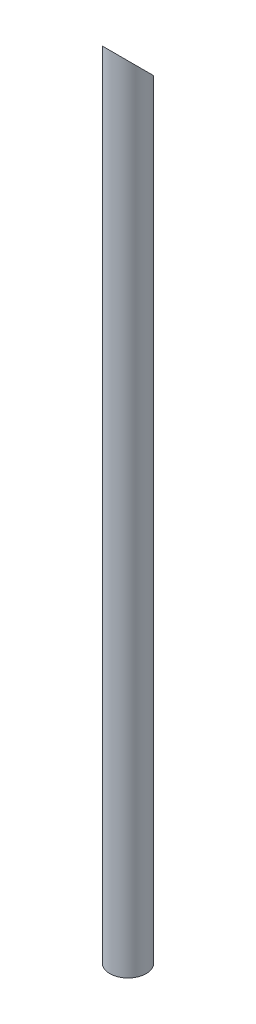
from build123d import *

# Parameters (mm, degrees)
SKETCH1_R               = 15.9
BOSS_EXTRUDE2_DEPTH     = 700
CUT_EXTRUDE1_DEPTH      = 701.361064023
CUT_EXTRUDE1_DEPTH_BACK = 701.361064023


with BuildPart() as part:
    # Sketch1 → Boss-Extrude2 (new body)
    with BuildSketch(Plane(origin=(0, 0, 0), x_dir=(1, 0, 0), z_dir=(0, 1, 0))):
        Circle(SKETCH1_R)
    extrude(amount=BOSS_EXTRUDE2_DEPTH)

    # Sketch2 → Cut-Extrude1 (cut, two sides: drawn at the far end of the back side and taken through both)
    with BuildSketch(Plane(origin=(0, 0, 0), x_dir=(0, 0, -1), z_dir=(1, 0, 0)).offset(-CUT_EXTRUDE1_DEPTH_BACK)):
        Polygon((15.9, 700), (-15.9, 700), (15.9, 668.2), align=None)
    extrude(amount=CUT_EXTRUDE1_DEPTH + CUT_EXTRUDE1_DEPTH_BACK, mode=Mode.SUBTRACT)


solid = part.part
